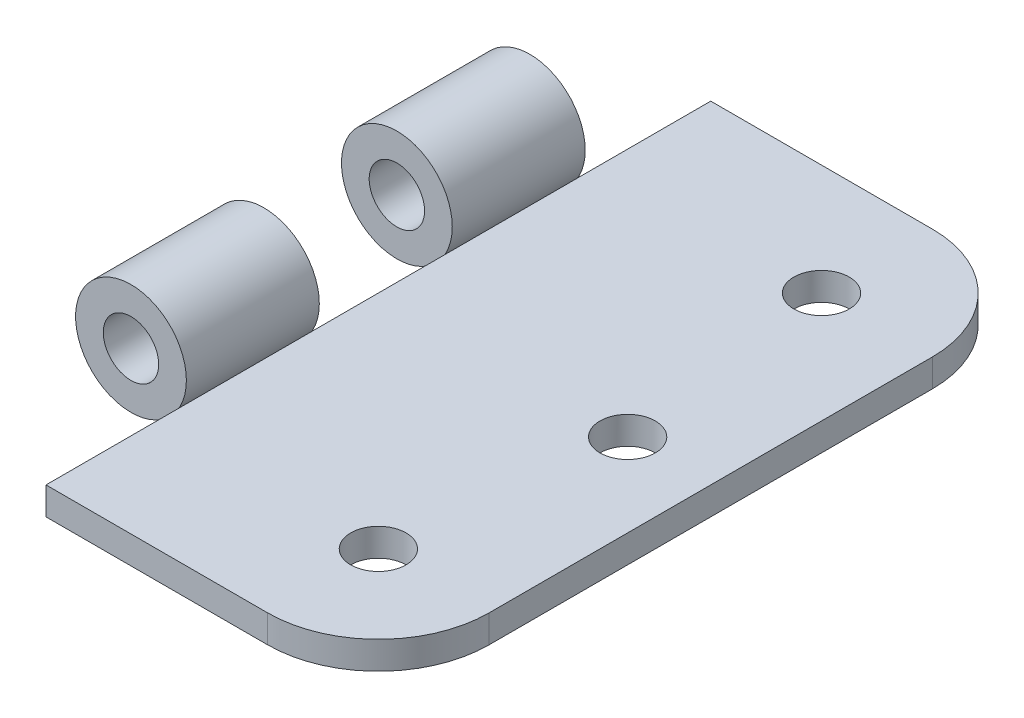
from build123d import *

# Parameters (mm, degrees)
SKETCH1_W           = 38.1
SKETCH1_H           = 76.2
BOSS_EXTRUDE1_DEPTH = 3.175
CUT_EXTRUDE1_REACH  = 87.253
SKETCH2_R           = 3.175
FILLET1_R           = 12.7
BOSS_EXTRUDE2_START = -15.24
SKETCH3_R           = 6.35
SKETCH3_R_2         = 3.175
BOSS_EXTRUDE2_DEPTH = 15.24
BOSS_EXTRUDE3_START = -45.72
SKETCH3_2_R         = 6.35
SKETCH3_2_R_2       = 3.175
BOSS_EXTRUDE3_DEPTH = 15.24


with BuildPart() as part:
    # Sketch1 → Boss-Extrude1 (new body)
    with BuildSketch(Plane(origin=(0, 0, 0), x_dir=(1, 0, 0), z_dir=(0, 1, 0))):
        with Locations((19.05, 38.1)):
            Rectangle(SKETCH1_W, SKETCH1_H)
    extrude(amount=BOSS_EXTRUDE1_DEPTH)

    # Sketch2 → Cut-Extrude1 (cut, up to next)
    with BuildSketch(Plane(origin=(0, 3.175, 0), x_dir=(-1, 0, 0), z_dir=(0, 1, 0)), mode=Mode.PRIVATE) as cut_extrude1_sk1:
        with Locations((-25.4, -63.5)):
            Circle(SKETCH2_R)
    cut_extrude1_tool1 = extrude(cut_extrude1_sk1.sketch, amount=-CUT_EXTRUDE1_REACH, mode=Mode.PRIVATE) & part.part
    # Sketch2 → Cut-Extrude1 (cut, up to next)
    with BuildSketch(Plane(origin=(0, 3.175, 0), x_dir=(-1, 0, 0), z_dir=(0, 1, 0)), mode=Mode.PRIVATE) as cut_extrude1_sk2:
        with Locations((-28.575, -38.1)):
            Circle(SKETCH2_R)
    cut_extrude1_tool2 = extrude(cut_extrude1_sk2.sketch, amount=-CUT_EXTRUDE1_REACH, mode=Mode.PRIVATE) & part.part
    # Sketch2 → Cut-Extrude1 (cut, up to next)
    with BuildSketch(Plane(origin=(0, 3.175, 0), x_dir=(-1, 0, 0), z_dir=(0, 1, 0)), mode=Mode.PRIVATE) as cut_extrude1_sk3:
        with Locations((-25.4, -12.7)):
            Circle(SKETCH2_R)
    cut_extrude1_tool3 = extrude(cut_extrude1_sk3.sketch, amount=-CUT_EXTRUDE1_REACH, mode=Mode.PRIVATE) & part.part
    add(cut_extrude1_tool1.solids().sort_by_distance((25.4, 3.175, -63.5))[0], mode=Mode.SUBTRACT)
    add(cut_extrude1_tool2.solids().sort_by_distance((28.575, 3.175, -38.1))[0], mode=Mode.SUBTRACT)
    add(cut_extrude1_tool3.solids().sort_by_distance((25.4, 3.175, -12.7))[0], mode=Mode.SUBTRACT)

    # Fillet1
    fillet1_edges = [part.edges().sort_by_distance(p)[0] for p in [
        (38.1, 1.5875, 0),
        (38.1, 1.5875, -76.2),
    ]]
    fillet(fillet1_edges, radius=FILLET1_R)


with BuildPart() as body_2:
    # Sketch3 → Boss-Extrude2 (new body)
    with BuildSketch(Plane.XY.offset(BOSS_EXTRUDE2_START)):
        with Locations((-5.499261314, 6.35)):
            Circle(SKETCH3_R)
        with Locations((-5.499261314, 6.35)):
            Circle(SKETCH3_R_2, mode=Mode.SUBTRACT)
    extrude(amount=-BOSS_EXTRUDE2_DEPTH)


with BuildPart() as body_3:
    # Sketch3<2> → Boss-Extrude3 (new body)
    with BuildSketch(Plane.XY.offset(BOSS_EXTRUDE3_START)):
        with Locations((-5.499261314, 6.35)):
            Circle(SKETCH3_2_R)
        with Locations((-5.499261314, 6.35)):
            Circle(SKETCH3_2_R_2, mode=Mode.SUBTRACT)
    extrude(amount=-BOSS_EXTRUDE3_DEPTH)


solid = Compound([part.part, body_2.part, body_3.part])
